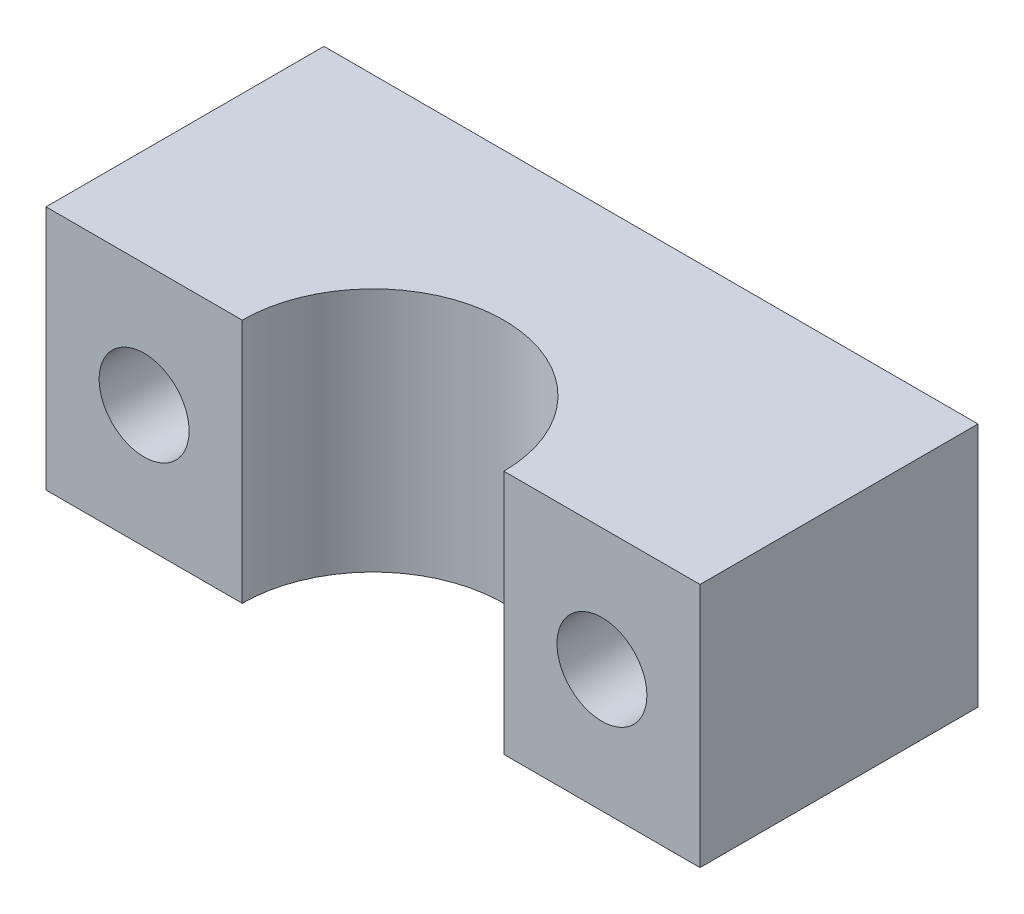
from build123d import *

# Parameters (mm, degrees)
SKETCH_1_W          = 40
SKETCH_1_H          = 15
EXTRUDE_1_DEPTH     = 17
SKETCH_2_R          = 8
CUT_EXTRUDE_1_DEPTH = 15
SKETCH_4_R          = 2.75
CUT_EXTRUDE_2_DEPTH = 46.97825573


with BuildPart() as part:
    # 草图1 → 凸台-拉伸1 (new body)
    with BuildSketch(Plane.XY):
        with Locations((20, -7.5)):
            Rectangle(SKETCH_1_W, SKETCH_1_H)
    extrude(amount=EXTRUDE_1_DEPTH)

    # 草图2 → 切除-拉伸1 (cut)
    with BuildSketch(Plane(origin=(0, 0, 0), x_dir=(1, 0, 0), z_dir=(0, 1, 0))):
        with Locations((20, -17)):
            Circle(SKETCH_2_R)
    extrude(amount=-CUT_EXTRUDE_1_DEPTH, mode=Mode.SUBTRACT)

    # 草图4 → 切除-拉伸2 (cut, through all)
    with BuildSketch(Plane.XY.offset(17)):
        with Locations((34, -7.5)):
            Circle(SKETCH_4_R)
        with Locations((6, -7.5)):
            Circle(SKETCH_4_R)
    extrude(amount=-CUT_EXTRUDE_2_DEPTH, mode=Mode.SUBTRACT)


solid = part.part
